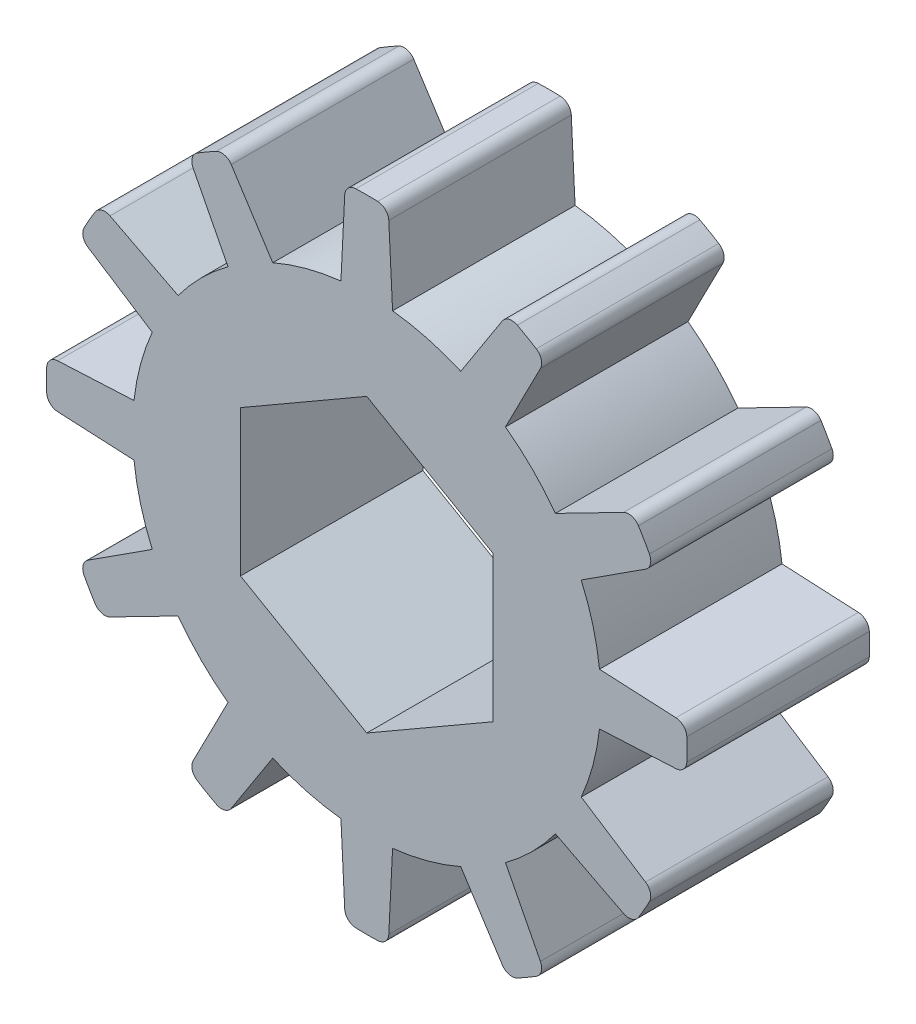
from build123d import *

# Parameters (mm, degrees)
CROQUIS1_R              = 0.5
SALIENTE_EXTRUIR1_DEPTH = 3.18
CORTAR_EXTRUIR3_DEPTH   = 9.508591314
REDONDEO1_R             = 0.2


with BuildPart() as part:
    # Croquis1 → Saliente-Extruir1 (new body)
    with BuildSketch(Plane.XY):
        with BuildLine():
            Line((0.375, 5.567875544), (0.45, 4.055600396))
            ThreePointArc((0.45, 4.055600396), (1.056108396, 3.941450193), (1.638088766, 3.737252971))
            Line((1.638088766, 3.737252971), (2.459178246, 5.009421667))
            ThreePointArc((2.459178246, 5.009421667), (2.790244751, 4.832845674), (3.108697299, 4.634421667))
            Line((3.108697299, 4.634421667), (2.41751163, 3.287252971))
            ThreePointArc((2.41751163, 3.287252971), (2.885341797, 2.885341797), (3.287252971, 2.41751163))
            Line((3.287252971, 2.41751163), (4.634421667, 3.108697299))
            ThreePointArc((4.634421667, 3.108697299), (4.832845674, 2.790244751), (5.009421667, 2.459178246))
            Line((5.009421667, 2.459178246), (3.737252971, 1.638088766))
            ThreePointArc((3.737252971, 1.638088766), (3.941450193, 1.056108396), (4.055600396, 0.45))
            Line((4.055600396, 0.45), (5.567875544, 0.375))
            ThreePointArc((5.567875544, 0.375), (5.580489502, 0), (5.567875544, -0.375))
            Line((5.567875544, -0.375), (4.055600396, -0.45))
            ThreePointArc((4.055600396, -0.45), (3.941450193, -1.056108396), (3.737252971, -1.638088766))
            Line((3.737252971, -1.638088766), (5.009421667, -2.459178246))
            ThreePointArc((5.009421667, -2.459178246), (4.832845674, -2.790244751), (4.634421667, -3.108697299))
            Line((4.634421667, -3.108697299), (3.287252971, -2.41751163))
            ThreePointArc((3.287252971, -2.41751163), (2.885341797, -2.885341797), (2.41751163, -3.287252971))
            Line((2.41751163, -3.287252971), (3.108697299, -4.634421667))
            ThreePointArc((3.108697299, -4.634421667), (2.790244751, -4.832845674), (2.459178246, -5.009421667))
            Line((2.459178246, -5.009421667), (1.638088766, -3.737252971))
            ThreePointArc((1.638088766, -3.737252971), (1.056108396, -3.941450193), (0.45, -4.055600396))
            Line((0.45, -4.055600396), (0.375, -5.567875544))
            ThreePointArc((0.375, -5.567875544), (0, -5.580489502), (-0.375, -5.567875544))
            Line((-0.375, -5.567875544), (-0.45, -4.055600396))
            ThreePointArc((-0.45, -4.055600396), (-1.056108396, -3.941450193), (-1.638088766, -3.737252971))
            Line((-1.638088766, -3.737252971), (-2.459178246, -5.009421667))
            ThreePointArc((-2.459178246, -5.009421667), (-2.790244751, -4.832845674), (-3.108697299, -4.634421667))
            Line((-3.108697299, -4.634421667), (-2.41751163, -3.287252971))
            ThreePointArc((-2.41751163, -3.287252971), (-2.885341797, -2.885341797), (-3.287252971, -2.41751163))
            Line((-3.287252971, -2.41751163), (-4.634421667, -3.108697299))
            ThreePointArc((-4.634421667, -3.108697299), (-4.832845674, -2.790244751), (-5.009421667, -2.459178246))
            Line((-5.009421667, -2.459178246), (-3.737252971, -1.638088766))
            ThreePointArc((-3.737252971, -1.638088766), (-3.941450193, -1.056108396), (-4.055600396, -0.45))
            Line((-4.055600396, -0.45), (-5.567875544, -0.375))
            ThreePointArc((-5.567875544, -0.375), (-5.580489502, 0), (-5.567875544, 0.375))
            Line((-5.567875544, 0.375), (-4.055600396, 0.45))
            ThreePointArc((-4.055600396, 0.45), (-3.941450193, 1.056108396), (-3.737252971, 1.638088766))
            Line((-3.737252971, 1.638088766), (-5.009421667, 2.459178246))
            ThreePointArc((-5.009421667, 2.459178246), (-4.832845674, 2.790244751), (-4.634421667, 3.108697299))
            Line((-4.634421667, 3.108697299), (-3.287252971, 2.41751163))
            ThreePointArc((-3.287252971, 2.41751163), (-2.885341797, 2.885341797), (-2.41751163, 3.287252971))
            Line((-2.41751163, 3.287252971), (-3.108697299, 4.634421667))
            ThreePointArc((-3.108697299, 4.634421667), (-2.790244751, 4.832845674), (-2.459178246, 5.009421667))
            Line((-2.459178246, 5.009421667), (-1.638088766, 3.737252971))
            ThreePointArc((-1.638088766, 3.737252971), (-1.056108396, 3.941450193), (-0.45, 4.055600396))
            Line((-0.45, 4.055600396), (-0.375, 5.567875544))
            ThreePointArc((-0.375, 5.567875544), (0, 5.580489502), (0.375, 5.567875544))
        make_face()
        Circle(CROQUIS1_R, mode=Mode.SUBTRACT)
    extrude(amount=SALIENTE_EXTRUIR1_DEPTH)

    # Croquis10 → Cortar-Extruir3 (cut, through all)
    with BuildSketch(Plane(origin=(0, 0, 0), x_dir=(-1, 0, 0), z_dir=(0, 0, -1))):
        Polygon((0, -2.540341184), (2.2, -1.270170592), (2.2, 1.270170592), (0, 2.540341184), (-2.2, 1.270170592), (-2.2, -1.270170592), align=None)
    extrude(amount=-CORTAR_EXTRUIR3_DEPTH, mode=Mode.SUBTRACT)

    # Redondeo1
    redondeo1_edges = [part.edges().sort_by_distance(p)[0] for p in [
        (5.567875544, -0.375, 1.59),
        (-2.459178246, -5.009421667, 1.59),
        (-3.108697299, -4.634421667, 1.59),
        (0.375, -5.567875544, 1.59),
        (-0.375, -5.567875544, 1.59),
        (3.108697299, -4.634421667, 1.59),
        (2.459178246, -5.009421667, 1.59),
        (5.009421667, -2.459178246, 1.59),
        (4.634421667, -3.108697299, 1.59),
        (-4.634421667, -3.108697299, 1.59),
        (-5.009421667, -2.459178246, 1.59),
        (-5.567875544, -0.375, 1.59),
        (-5.567875544, 0.375, 1.59),
        (-5.009421667, 2.459178246, 1.59),
        (-4.634421667, 3.108697299, 1.59),
        (-3.108697299, 4.634421667, 1.59),
        (-2.459178246, 5.009421667, 1.59),
        (5.567875544, 0.375, 1.59),
        (5.009421667, 2.459178246, 1.59),
        (4.634421667, 3.108697299, 1.59),
        (3.108697299, 4.634421667, 1.59),
        (2.459178246, 5.009421667, 1.59),
        (0.375, 5.567875544, 1.59),
        (-0.375, 5.567875544, 1.59),
    ]]
    fillet(redondeo1_edges, radius=REDONDEO1_R)


solid = part.part
